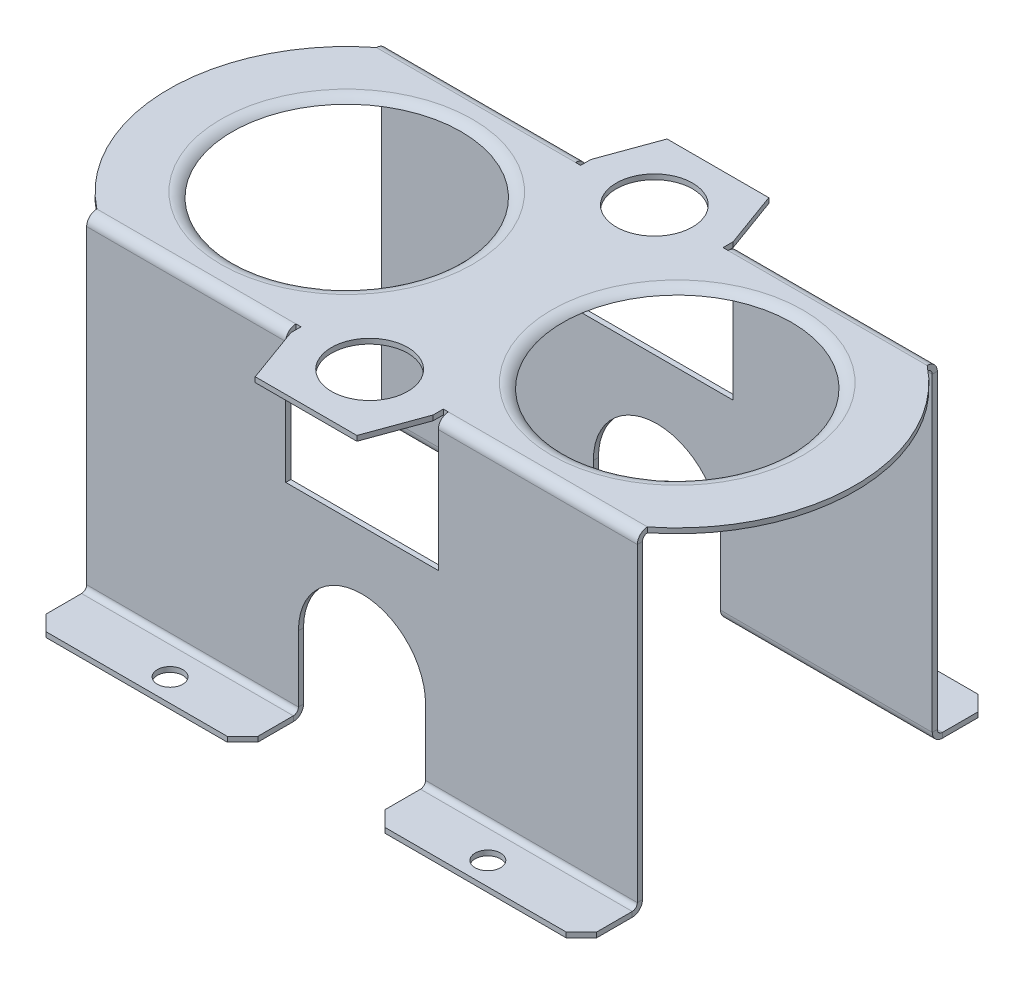
from build123d import *

# Parameters (mm, degrees)
SKETCH1_R                      = 2.25
BASE_FLANGE1_DEPTH             = 0.1
EDGE_FLANGE1_STRIP_W           = 0.6
EDGE_FLANGE1_STRIP_H           = 0.1
EDGE_FLANGE1_STRIP_CUT_DEPTH   = 10.83
EDGE_FLANGE1_STRIP_2_W         = 0.6
EDGE_FLANGE1_STRIP_2_H         = 0.1
EDGE_FLANGE1_STRIP_CUT_2_DEPTH = 10.83
EDGE_FLANGE1_DEPTH             = 10.83
EDGE_FLANGE1_BEND_DEPTH        = 10.83
EDGE_FLANGE2_STRIP_W           = 0.6
EDGE_FLANGE2_STRIP_H           = 0.1
EDGE_FLANGE2_STRIP_CUT_DEPTH   = 10.83
EDGE_FLANGE2_STRIP_2_W         = 0.6
EDGE_FLANGE2_STRIP_2_H         = 0.1
EDGE_FLANGE2_STRIP_CUT_2_DEPTH = 10.83
EDGE_FLANGE2_DEPTH             = 10.83
EDGE_FLANGE2_BEND_DEPTH        = 10.83
CUT_EXTRUDE1_DEPTH             = 13.595815176
CUT_EXTRUDE1_DEPTH_BACK        = 13.595815176
CUT_EXTRUDE2_START             = -2.6
CUT_EXTRUDE2_OUTLINE_W         = 3
CUT_EXTRUDE2_OUTLINE_H         = 0.2
CUT_EXTRUDE2_DEPTH             = 2.6
TAB1_DEPTH                     = 0.1
CUT_EXTRUDE3_REACH             = 14.596
SKETCH23_R                     = 0.75
CUT_EXTRUDE3_DIRECTION_2_DEPTH = 13.595815176
BREAK_CORNER1_START            = -6.5
BREAK_CORNER1_DEPTH            = 0.1
FILLET1_R                      = 0.3
SKETCH24_R                     = 0.25
CUT_EXTRUDE4_DEPTH             = 10


# Read off the part's stored shape, not the designer's step: Cut-Extrude2, Break-Corner1
# Sheet-metal steps are written as plain solids
with BuildPart() as part:
    # Sketch1 → Base-Flange1 (new body)
    with BuildSketch(Plane(origin=(0, 0, 0), x_dir=(1, 0, 0), z_dir=(0, 1, 0))):
        with BuildLine():
            Line((-8.665102996, -2.95), (2.164897004, -2.95))
            Line((2.164897004, -2.95), (2.164897004, -2.75))
            ThreePointArc((2.164897004, -2.75), (3.499897004, 0), (2.164897004, 2.75))
            Line((2.164897004, 2.75), (2.164897004, 2.95))
            Line((2.164897004, 2.95), (-8.665102996, 2.95))
            Line((-8.665102996, 2.95), (-8.665102996, 2.75))
            ThreePointArc((-8.665102996, 2.75), (-10.000102996, 0), (-8.665102996, -2.75))
            Line((-8.665102996, -2.75), (-8.665102996, -2.95))
        make_face()
        with Locations(Location((0, 0, 0), (0, 0, 270))):
            Circle(SKETCH1_R, mode=Mode.SUBTRACT)
        with Locations(Location((-6.500205993, 0, 0), (0, 0, 270))):
            Circle(SKETCH1_R, mode=Mode.SUBTRACT)
    extrude(amount=-BASE_FLANGE1_DEPTH)

    # Edge-Flange1 strip (across the edge) → Edge-Flange1 strip cut (cut)
    with BuildSketch(Plane(origin=(2.164897004, -0.1, 2.95), x_dir=(0, 0, -1), z_dir=(-1, 0, 0))):
        with Locations((-0.1, -0.05)):
            Rectangle(EDGE_FLANGE1_STRIP_W, EDGE_FLANGE1_STRIP_H)
    extrude(amount=EDGE_FLANGE1_STRIP_CUT_DEPTH, mode=Mode.SUBTRACT)

    # Edge-Flange1 strip 2 (across the edge) → Edge-Flange1 strip cut 2 (cut)
    with BuildSketch(Plane(origin=(-8.665102996, -0.1, -2.95), x_dir=(0, 0, 1), z_dir=(1, 0, 0))):
        with Locations((-0.1, -0.05)):
            Rectangle(EDGE_FLANGE1_STRIP_2_W, EDGE_FLANGE1_STRIP_2_H)
    extrude(amount=EDGE_FLANGE1_STRIP_CUT_2_DEPTH, mode=Mode.SUBTRACT)

    # Edge-Flange1 section (across the edge) → Edge-Flange1 (add)
    with BuildSketch(Plane(origin=(2.164897004, -0.1, 2.95), x_dir=(0, 0, -1), z_dir=(-1, 0, 0))):
        with BuildLine():
            Line((0, 0.1), (0, 6.4))
            Line((0, 6.4), (0.1, 6.4))
            Line((0.1, 6.4), (0.1, 0.1))
            ThreePointArc((0.1, 0.1), (0.129289322, 0.029289322), (0.2, 0))
            Line((0.2, 0), (0.2, -0.1))
            ThreePointArc((0.2, -0.1), (0.058578644, -0.041421356), (0, 0.1))
        make_face()
    extrude(amount=EDGE_FLANGE1_DEPTH)

    # Edge-Flange1 section 2 (across the edge) → Edge-Flange1 bend (add)
    with BuildSketch(Plane(origin=(-8.665102996, -0.1, -2.95), x_dir=(0, 0, 1), z_dir=(1, 0, 0))):
        with BuildLine():
            Line((0, 0.1), (0, 6.4))
            Line((0, 6.4), (0.1, 6.4))
            Line((0.1, 6.4), (0.1, 0.1))
            ThreePointArc((0.1, 0.1), (0.129289322, 0.029289322), (0.2, 0))
            Line((0.2, 0), (0.2, -0.1))
            ThreePointArc((0.2, -0.1), (0.058578644, -0.041421356), (0, 0.1))
        make_face()
    extrude(amount=EDGE_FLANGE1_BEND_DEPTH)

    # Edge-Flange2 strip (across the edge) → Edge-Flange2 strip cut (cut)
    with BuildSketch(Plane(origin=(-8.665102996, -6.5, 2.95), x_dir=(0, 1, 0), z_dir=(1, 0, 0))):
        with Locations((-0.1, -0.05)):
            Rectangle(EDGE_FLANGE2_STRIP_W, EDGE_FLANGE2_STRIP_H)
    extrude(amount=EDGE_FLANGE2_STRIP_CUT_DEPTH, mode=Mode.SUBTRACT)

    # Edge-Flange2 strip 2 (across the edge) → Edge-Flange2 strip cut 2 (cut)
    with BuildSketch(Plane(origin=(2.164897004, -6.5, -2.95), x_dir=(0, 1, 0), z_dir=(-1, 0, 0))):
        with Locations((-0.1, -0.05)):
            Rectangle(EDGE_FLANGE2_STRIP_2_W, EDGE_FLANGE2_STRIP_2_H)
    extrude(amount=EDGE_FLANGE2_STRIP_CUT_2_DEPTH, mode=Mode.SUBTRACT)

    # Edge-Flange2 section (across the edge) → Edge-Flange2 (add)
    with BuildSketch(Plane(origin=(-8.665102996, -6.5, 2.95), x_dir=(0, 1, 0), z_dir=(1, 0, 0))):
        with BuildLine():
            Line((0, 0.1), (0, 1.1))
            Line((0, 1.1), (0.1, 1.1))
            Line((0.1, 1.1), (0.1, 0.1))
            ThreePointArc((0.1, 0.1), (0.129289322, 0.029289322), (0.2, 0))
            Line((0.2, 0), (0.2, -0.1))
            ThreePointArc((0.2, -0.1), (0.058578644, -0.041421356), (0, 0.1))
        make_face()
    extrude(amount=EDGE_FLANGE2_DEPTH)

    # Edge-Flange2 section 2 (across the edge) → Edge-Flange2 bend (add)
    with BuildSketch(Plane(origin=(2.164897004, -6.5, -2.95), x_dir=(0, 1, 0), z_dir=(-1, 0, 0))):
        with BuildLine():
            Line((0, 0.1), (0, 1.1))
            Line((0, 1.1), (0.1, 1.1))
            Line((0.1, 1.1), (0.1, 0.1))
            ThreePointArc((0.1, 0.1), (0.129289322, 0.029289322), (0.2, 0))
            Line((0.2, 0), (0.2, -0.1))
            ThreePointArc((0.2, -0.1), (0.058578644, -0.041421356), (0, 0.1))
        make_face()
    extrude(amount=EDGE_FLANGE2_BEND_DEPTH)

    # Sketch18 → Cut-Extrude1 (cut, two sides: drawn at the far end of the back side and taken through both)
    with BuildSketch(Plane.XY.offset(-CUT_EXTRUDE1_DEPTH_BACK)):
        with BuildLine():
            Line((-4.500102996, -6.5), (-4.500102996, -5))
            ThreePointArc((-4.500102996, -5), (-3.250102996, -3.75), (-2.000102996, -5))
            Line((-2.000102996, -5), (-2.000102996, -6.5))
            Line((-2.000102996, -6.5), (-4.500102996, -6.5))
        make_face()
    extrude(amount=CUT_EXTRUDE1_DEPTH + CUT_EXTRUDE1_DEPTH_BACK, mode=Mode.SUBTRACT)

    # Cut-Extrude2 outline → Cut-Extrude2 (cut)
    with BuildSketch(Plane(origin=(0, 0, 0), x_dir=(1, 0, 0), z_dir=(0, 1, 0)).offset(CUT_EXTRUDE2_START)):
        with Locations((-3.250102996, 2.85)):
            Rectangle(CUT_EXTRUDE2_OUTLINE_W, CUT_EXTRUDE2_OUTLINE_H)
        with Locations((-3.250102996, -2.85)):
            Rectangle(CUT_EXTRUDE2_OUTLINE_W, CUT_EXTRUDE2_OUTLINE_H)
    extrude(amount=CUT_EXTRUDE2_DEPTH, mode=Mode.SUBTRACT)

    # Sketch20 → Tab1 (add)
    with BuildSketch(Plane(origin=(0, 0, 0), x_dir=(1, 0, 0), z_dir=(0, 1, 0))):
        Polygon((-4.650102996, -2.75), (-4.650102996, -2.95), (-4.250102996, -4.05), (-2.250102996, -4.05), (-1.850102996, -2.95), (-1.850102996, -2.75), align=None)
    tab1 = extrude(amount=-TAB1_DEPTH)

    # Sketch23 → Cut-Extrude3 (cut, up to next)
    with BuildSketch(Plane(origin=(0, 0, 0), x_dir=(1, 0, 0), z_dir=(0, 1, 0)), mode=Mode.PRIVATE) as cut_extrude3_sk1:
        with Locations(Location((-3.250102996, -2.8, 0), (0, 0, 90))):
            Circle(SKETCH23_R)
    cut_extrude3_tool1 = extrude(cut_extrude3_sk1.sketch, amount=-CUT_EXTRUDE3_REACH, mode=Mode.PRIVATE) & part.part
    cut_extrude3 = cut_extrude3_tool1.solids().sort_by_distance((-3.250103, 0, 2.8))[0]
    add(cut_extrude3, mode=Mode.SUBTRACT)

    # Sketch23 → Cut-Extrude3 direction 2 (cut)
    with BuildSketch(Plane(origin=(0, 0, 0), x_dir=(1, 0, 0), z_dir=(0, 1, 0))):
        with Locations(Location((-3.250102996, -2.8, 0), (0, 0, 90))):
            Circle(SKETCH23_R)
    cut_extrude3_direction_2 = extrude(amount=CUT_EXTRUDE3_DIRECTION_2_DEPTH, mode=Mode.SUBTRACT)

    # Mirror1: Tab1, Cut-Extrude3, Cut-Extrude3 direction 2 across plane
    add(tab1.mirror(Plane.XY))
    add(cut_extrude3.mirror(Plane.XY), mode=Mode.SUBTRACT)
    add(cut_extrude3_direction_2.mirror(Plane.XY), mode=Mode.SUBTRACT)

    # Break-Corner1 outline → Break-Corner1 (cut)
    with BuildSketch(Plane(origin=(0, 0, 0), x_dir=(1, 0, 0), z_dir=(0, 1, 0)).offset(BREAK_CORNER1_START)):
        Polygon((-2.000102996, -4.05), (-1.700102996, -4.05), (-2.000102996, -3.75), align=None)
        Polygon((2.164897004, -3.75), (1.864897004, -4.05), (2.164897004, -4.05), align=None)
        Polygon((-4.500102996, -4.05), (-4.500102996, -3.75), (-4.800102996, -4.05), align=None)
        Polygon((-8.665102996, -4.05), (-8.365102996, -4.05), (-8.665102996, -3.75), align=None)
        Polygon((-2.000102996, 4.05), (-2.000102996, 3.75), (-1.700102996, 4.05), align=None)
        Polygon((2.164897004, 4.05), (1.864897004, 4.05), (2.164897004, 3.75), align=None)
        Polygon((-4.500102996, 4.05), (-4.800102996, 4.05), (-4.500102996, 3.75), align=None)
        Polygon((-8.665102996, 3.75), (-8.365102996, 4.05), (-8.665102996, 4.05), align=None)
    extrude(amount=BREAK_CORNER1_DEPTH, mode=Mode.SUBTRACT)

    # Fillet1
    # the kernel refuses this fillet: 0.3 mm, written as the material it takes off along each edge
    with BuildSketch(Plane(origin=(0, 0, 0), x_dir=(0, 0, 1), z_dir=(-1, 0, 0))) as fillet1_piece_1:
        with BuildLine():
            CenterArc((2.473606798, -0.3), FILLET1_R, 90, 48.189685104)
            Line((2.25, -0.1), (2.245527864, -0.096))
            ThreePointArc((2.245527864, -0.096), (2.244, -0.05), (2.244, 0))
            Line((2.244, 0), (2.25, 0.006))
            Line((2.25, 0.006), (2.473606798, 0.006))
            Line((2.473606798, 0.006), (2.473606798, 0))
        make_face()
    revolve(axis=Axis((0, 0, 0), (0, 1, 0)), mode=Mode.SUBTRACT)
    with BuildSketch(Plane(origin=(-6.500205993, 0, 0), x_dir=(0, 0, 1), z_dir=(-1, 0, 0))) as fillet1_piece_2:
        with BuildLine():
            CenterArc((2.473606798, -0.3), FILLET1_R, 90, 48.189685104)
            Line((2.25, -0.1), (2.245527864, -0.096))
            ThreePointArc((2.245527864, -0.096), (2.244, -0.05), (2.244, 0))
            Line((2.244, 0), (2.25, 0.006))
            Line((2.25, 0.006), (2.473606798, 0.006))
            Line((2.473606798, 0.006), (2.473606798, 0))
        make_face()
    revolve(axis=Axis((-6.500205993, 0, 0), (0, 1, 0)), mode=Mode.SUBTRACT)

    # Sketch24 → Cut-Extrude4 (cut)
    with BuildSketch(Plane(origin=(0, -6.4, 0), x_dir=(1, 0, 0), z_dir=(0, 1, 0))):
        with Locations(Location((-6.375102996, 3.6, 0), (0, 0, 270))):
            Circle(SKETCH24_R)
        with Locations(Location((-0.125102996, 3.6, 0), (0, 0, 90))):
            Circle(SKETCH24_R)
        with Locations(Location((-0.125102996, -3.6, 0), (0, 0, 270))):
            Circle(SKETCH24_R)
        with Locations(Location((-6.375102996, -3.6, 0), (0, 0, 90))):
            Circle(SKETCH24_R)
    extrude(amount=-CUT_EXTRUDE4_DEPTH, mode=Mode.SUBTRACT)


solid = part.part
